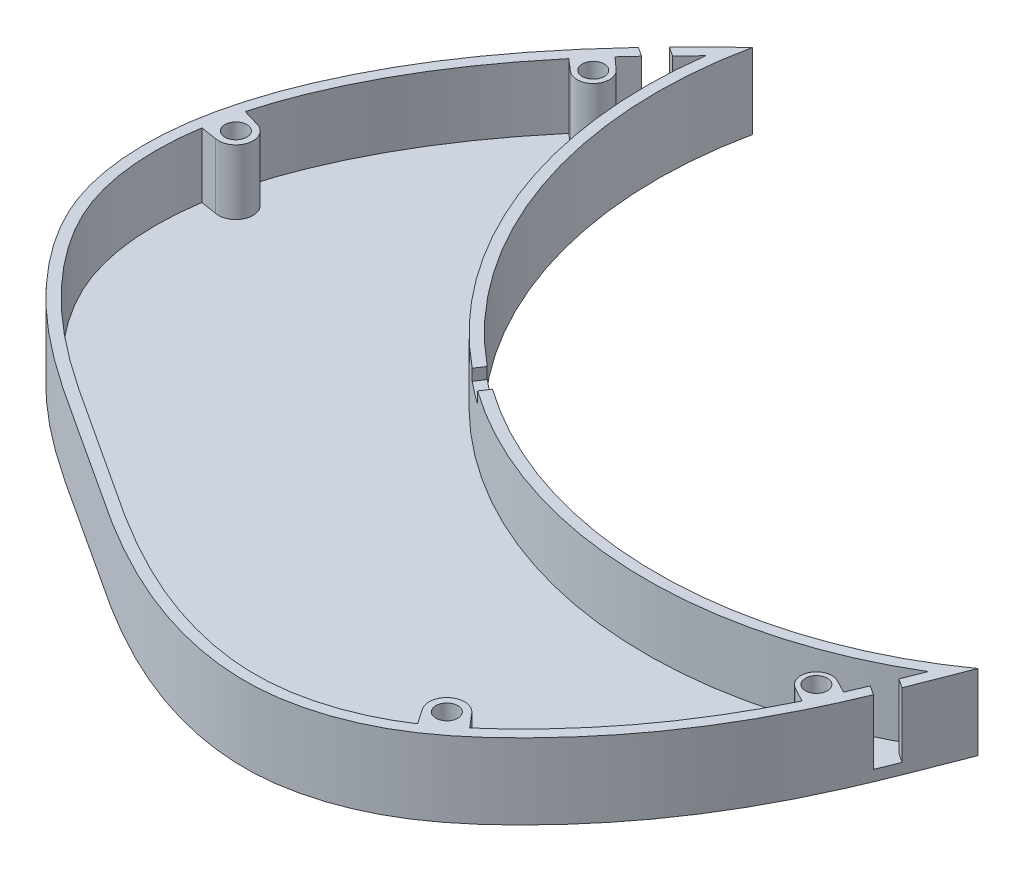
from build123d import *

# Parameters (mm, degrees)
SKETCH1_R               = 29.547894384
BOSS_EXTRUDE1_DEPTH     = 2.54
BOSS_EXTRUDE3_DEPTH     = 22.5
SHELL1_T                = -2.5
BOSS_EXTRUDE5_OUTLINE_R = 2.54
BOSS_EXTRUDE5_DEPTH     = 20
CUT_EXTRUDE1_START      = -126.492
SKETCH6_R               = 2.54
CUT_EXTRUDE1_DEPTH      = 126.492
SKETCH7_R               = 162.597959588
CUT_EXTRUDE2_DEPTH      = 5
SKETCH9_W               = 6.49560705
SKETCH9_H               = 4.341442035
CUT_EXTRUDE3_DEPTH      = 75.198
SKETCH10_W              = 5
SKETCH10_H              = 15
CUT_EXTRUDE4_DEPTH      = 29.732


with BuildPart() as part:
    # Sketch1 → Boss-Extrude1 (new body)
    with BuildSketch(Plane(origin=(0, 0, 0), x_dir=(1, 0, 0), z_dir=(0, 1, 0))):
        with Locations(Location((0, 0, 0), (0, 0, 270))):
            Circle(SKETCH1_R)
    extrude(amount=BOSS_EXTRUDE1_DEPTH)

    # Sketch3 → Boss-Extrude3 (add)
    with BuildSketch(Plane(origin=(0, 2.54, 0), x_dir=(1, 0, 0), z_dir=(0, 1, 0))):
        with BuildLine():
            ThreePointArc((127.875974005, 31.228552051), (18.703173635, 28.850781975), (-22.974511578, 129.783059698))
            add(Edge.make_bspline(
                [(127.875974005, 31.228552051), (124.833194756, 23.500046838), (118.641298426, 6.732816255), (106.2640482, -15.888923237), (90.229420956, -35.183327676), (72.171606742, -50.812998846), (49.785235351, -57.770249666), (24.426790925, -54.06366462), (2.074849914, -42.979402306), (-20.768487962, -27.178921315), (-42.903758871, -13.755142711), (-60.538972474, 2.714042788), (-72.749741471, 21.786382128), (-75.584439975, 46.947267513), (-67.460164465, 72.674532823), (-54.745227653, 94.596522932), (-40.115632718, 112.889033363), (-29.143559613, 123.977604036), (-22.974511578, 129.783059698)],
                knots=[0, 0, 0, 0, 0.063251183, 0.134892559, 0.194160651, 0.252763499, 0.313609905, 0.364725042, 0.443291661, 0.500212587, 0.57542796, 0.638938825, 0.681384578, 0.744407933, 0.8230362, 0.881899204, 0.935822614, 1, 1, 1, 1], degree=3))
        make_face()
    extrude(amount=-BOSS_EXTRUDE3_DEPTH)

    # Shell1
    shell1_openings = [part.faces().sort_by_distance(p)[0] for p in [
        (8.28439244, 2.54, -12.823447747),
    ]]
    offset(amount=SHELL1_T, openings=shell1_openings)

    # Boss-Extrude5: read off the stored shape, not the designer's step
    # Boss-Extrude5 outline → Boss-Extrude5 (add)
    # profile 1 of 4: a face of its own
    with BuildSketch(Plane(origin=(0, -17.46, 0), x_dir=(1, 0, 0), z_dir=(0, 1, 0))):
        with BuildLine():
            Line((110.639634447, 6.106527354), (113.999146446, 4.291322777))
            add(Edge.make_bspline(
                [(113.999146446, 4.291322777), (114.076340447, 4.449995099), (114.1533589, 4.608760534), (114.230202047, 4.76761856), (114.306870129, 4.926568654), (114.383363387, 5.085610292), (114.459682061, 5.244742951), (114.535826394, 5.403966109), (114.611796627, 5.563279241), (114.687593, 5.722681826), (114.763215754, 5.88217334), (114.838665131, 6.041753259), (114.913941373, 6.201421061), (114.989044719, 6.361176223), (115.156654737, 6.718721567), (115.249068242, 6.916554338), (115.341229985, 7.114543125), (115.433090629, 7.312585636), (115.524755692, 7.510895549), (115.616097338, 7.709208007), (115.707176845, 7.907649412), (115.79806086, 8.106353034), (115.888630062, 8.305069079), (115.978898725, 8.503829818), (116.069032234, 8.702974759), (116.158782448, 8.90197836), (116.248329055, 9.101229068), (116.3888369, 9.414955458), (116.439966191, 9.529344017), (116.491016146, 9.643780601), (116.541987391, 9.758264867), (116.592880551, 9.872796473), (116.643696255, 9.987375073), (116.694435127, 10.102000325), (116.745097794, 10.216671885), (116.795684884, 10.331389409), (116.846197023, 10.446152553), (116.896634839, 10.560960972), (116.946998959, 10.675814321), (116.997290011, 10.790712256), (117.047508623, 10.905654431)],
                knots=[0.923371139, 0.923371139, 0.923371139, 0.923371139, 0.923371139, 0.923371139, 0.923371139, 0.923371139, 0.923371139, 0.923371139, 0.923371139, 0.923371139, 0.923371139, 0.923371139, 0.923371139, 0.9296875, 0.9296875, 0.9296875, 0.9296875, 0.9296875, 0.9296875, 0.9296875, 0.9296875, 0.9296875, 0.9296875, 0.9296875, 0.9296875, 0.9296875, 0.9375, 0.9375, 0.9375, 0.9375, 0.9375, 0.9375, 0.9375, 0.9375, 0.9375, 0.9375, 0.9375, 0.9375, 0.9375, 0.941980163, 0.941980163, 0.941980163, 0.941980163, 0.941980163, 0.941980163, 0.941980163, 0.941980163, 0.941980163, 0.941980163, 0.941980163, 0.941980163, 0.941980163, 0.941980163, 0.941980163], degree=14))
            Line((117.047508623, 10.905654431), (113.999147482, 12.475090974))
            ThreePointArc((113.999147482, 12.475090974), (109.166676585, 10.953913387), (110.639634447, 6.106527354))
        make_face()
        with Locations((112.351116434, 9.274073502)):
            Circle(BOSS_EXTRUDE5_OUTLINE_R, mode=Mode.SUBTRACT)
    # profile 2 of 4: a face of its own
    with BuildSketch(Plane(origin=(0, -17.46, 0), x_dir=(1, 0, 0), z_dir=(0, 1, 0))):
        with BuildLine():
            Line((71.6444427, -41.364698196), (74.012293949, -44.839818224))
            add(Edge.make_bspline(
                [(74.012293949, -44.839818224), (74.523501356, -44.502319139), (75.031427178, -44.159116888), (75.536127474, -43.810336851), (76.037657449, -43.456105253), (76.536071545, -43.096549167), (77.031423539, -42.731796495), (77.523766628, -42.361975971), (78.013153527, -41.987217148), (78.499636563, -41.607650389), (78.983267762, -41.223406867), (79.464098947, -40.83461855), (79.942181827, -40.441418197), (80.417568094, -40.043939352), (80.89030951, -39.642316335)],
                knots=[0.758615849, 0.758615849, 0.758615849, 0.758615849, 0.758615849, 0.758615849, 0.758615849, 0.758615849, 0.758615849, 0.758615849, 0.758615849, 0.758615849, 0.758615849, 0.758615849, 0.758615849, 0.781111669, 0.781111669, 0.781111669, 0.781111669, 0.781111669, 0.781111669, 0.781111669, 0.781111669, 0.781111669, 0.781111669, 0.781111669, 0.781111669, 0.781111669, 0.781111669, 0.781111669], degree=14))
            Line((80.89030951, -39.642316335), (78.139509578, -36.410374286))
            ThreePointArc((78.139509578, -36.410374286), (72.543960265, -35.809311965), (71.6444427, -41.364698196))
        make_face()
        with Locations((75.02467388, -39.061501593)):
            Circle(BOSS_EXTRUDE5_OUTLINE_R, mode=Mode.SUBTRACT)
    # profile 3 of 4: a face of its own
    with BuildSketch(Plane(origin=(0, -17.46, 0), x_dir=(1, 0, 0), z_dir=(0, 1, 0))):
        with BuildLine():
            add(Edge.make_bspline(
                [(-37.03646619, 111.958232071), (-37.134434737, 111.849812567), (-37.232327084, 111.741327174), (-37.330143017, 111.632775735), (-37.427882321, 111.52415809), (-37.525544782, 111.415474082), (-37.623130185, 111.30672355), (-37.720638316, 111.197906338), (-37.81806896, 111.089022285), (-37.915421903, 110.980071234), (-38.012696932, 110.871053025), (-38.10989383, 110.7619675), (-38.207012385, 110.652814501), (-38.304052382, 110.543593868), (-38.663744799, 110.138171825), (-38.925897385, 109.841539724), (-39.187476607, 109.544400021), (-39.44844652, 109.246779959), (-39.708808146, 108.948665953), (-39.968558117, 108.650050309), (-40.227687141, 108.350932104), (-40.486185493, 108.051310753), (-40.744044677, 107.751184212), (-41.001256881, 107.450549658), (-41.257814324, 107.149404262), (-41.513709042, 106.847745417), (-41.768932937, 106.545570687), (-42.023477868, 106.242877679)],
                knots=[0.057278168, 0.057278168, 0.057278168, 0.057278168, 0.057278168, 0.057278168, 0.057278168, 0.057278168, 0.057278168, 0.057278168, 0.057278168, 0.057278168, 0.057278168, 0.057278168, 0.057278168, 0.0625, 0.0625, 0.0625, 0.0625, 0.0625, 0.0625, 0.0625, 0.0625, 0.0625, 0.0625, 0.0625, 0.0625, 0.0625, 0.076649348, 0.076649348, 0.076649348, 0.076649348, 0.076649348, 0.076649348, 0.076649348, 0.076649348, 0.076649348, 0.076649348, 0.076649348, 0.076649348, 0.076649348, 0.076649348, 0.076649348], degree=14))
            Line((-42.023477868, 106.242877679), (-39.294490143, 103.896198179))
            ThreePointArc((-39.294490143, 103.896198179), (-34.015669895, 104.269276929), (-34.339930798, 109.551320647))
            Line((-34.339930798, 109.551320647), (-37.03646619, 111.958232071))
        make_face()
        with Locations((-36.843351969, 106.746662472)):
            Circle(BOSS_EXTRUDE5_OUTLINE_R, mode=Mode.SUBTRACT)
    # profile 4 of 4: a face of its own
    with BuildSketch(Plane(origin=(0, -17.46, 0), x_dir=(1, 0, 0), z_dir=(0, 1, 0))):
        with BuildLine():
            Line((-64.495227238, 56.792806506), (-68.907426811, 58.1037729))
            add(Edge.make_bspline(
                [(-68.907426811, 58.1037729), (-69.065889356, 57.517816988), (-69.219640328, 56.930888), (-69.368609064, 56.343002319), (-69.512725072, 55.754176116), (-69.651918031, 55.164425324), (-69.78611778, 54.573765628), (-69.915254315, 53.982212444), (-70.039257779, 53.3897809), (-70.158058456, 52.79648582), (-70.271586757, 52.202341701), (-70.379773209, 51.6073627), (-70.482548446, 51.011562606), (-70.57984319, 50.414954825), (-70.671588239, 49.817552359)],
                knots=[0.219404735, 0.219404735, 0.219404735, 0.219404735, 0.219404735, 0.219404735, 0.219404735, 0.219404735, 0.219404735, 0.219404735, 0.219404735, 0.219404735, 0.219404735, 0.219404735, 0.219404735, 0.241415819, 0.241415819, 0.241415819, 0.241415819, 0.241415819, 0.241415819, 0.241415819, 0.241415819, 0.241415819, 0.241415819, 0.241415819, 0.241415819, 0.241415819, 0.241415819, 0.241415819], degree=14))
            Line((-70.671588239, 49.817552359), (-66.910830003, 49.239976375))
            ThreePointArc((-66.910830003, 49.239976375), (-62.314759261, 51.932729728), (-64.495227238, 56.792806506))
        make_face()
        with Locations((-66.113406486, 53.147641566)):
            Circle(BOSS_EXTRUDE5_OUTLINE_R, mode=Mode.SUBTRACT)
    extrude(amount=BOSS_EXTRUDE5_DEPTH)

    # Sketch6 → Cut-Extrude1 (cut)
    with BuildSketch(Plane(origin=(0, 2.54, 0), x_dir=(1, 0, 0), z_dir=(0, 1, 0)).offset(CUT_EXTRUDE1_START)):
        with Locations(Location((-66.113406486, 53.147641566, 0), (0, 0, 90))):
            Circle(SKETCH6_R)
        with Locations(Location((-36.843351969, 106.746662472, 0), (0, 0, 90))):
            Circle(SKETCH6_R)
        with Locations(Location((112.351116434, 9.274073502, 0), (0, 0, 90))):
            Circle(SKETCH6_R)
        with Locations(Location((75.02467388, -39.061501593, 0), (0, 0, 90))):
            Circle(SKETCH6_R)
    extrude(amount=CUT_EXTRUDE1_DEPTH, mode=Mode.SUBTRACT)

    # Sketch7 → Cut-Extrude2 (cut)
    with BuildSketch(Plane(origin=(0, 2.54, 0), x_dir=(1, 0, 0), z_dir=(0, 1, 0))):
        Circle(SKETCH7_R)
    extrude(amount=-CUT_EXTRUDE2_DEPTH, mode=Mode.SUBTRACT)

    # Sketch9 → Cut-Extrude3 (cut)
    with BuildSketch(Plane(origin=(52.55290517, 0, -80.439052997), x_dir=(-0.8371691043312223, 0, -0.5469441386039888), z_dir=(0.5469441386039887, 0, -0.8371691043312222))):
        with Locations((7.247803525, -2.924305392)):
            Rectangle(SKETCH9_W, SKETCH9_H)
    extrude(amount=-CUT_EXTRUDE3_DEPTH, mode=Mode.SUBTRACT)

    # Sketch10 → Cut-Extrude4 (cut)
    with BuildSketch(Plane(origin=(48.487168514, 46.616399571, -290.00203491), x_dir=(0.5469441386039885, 0, -0.8371691043312223), z_dir=(-0.8371691043312223, 0, -0.5469441386039885))):
        with Locations((-189.018630621, 56.576399571)):
            Rectangle(SKETCH10_W, SKETCH10_H)
    cut_extrude4 = extrude(amount=-CUT_EXTRUDE4_DEPTH, mode=Mode.SUBTRACT)

    # Mirror1: Cut-Extrude4 across plane
    add(cut_extrude4.mirror(Plane(origin=(-0.102173957, 0, -0.066752878), x_dir=(-0.5469441386039884, 0, 0.8371691043312224), z_dir=(0.8371691043312224, 0, 0.5469441386039884))), mode=Mode.SUBTRACT)


solid = part.part
